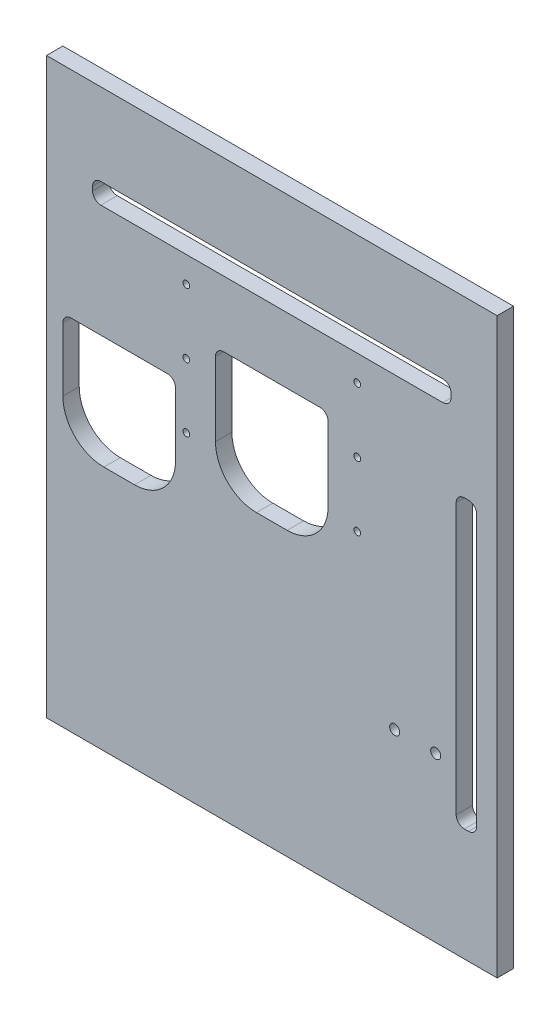
from build123d import *

# Parameters (mm, degrees)
ESQUISSE1_W                  = 220
ESQUISSE1_H                  = 280
BOSS_EXTRU_1_DEPTH           = 8
ESQUISSE2_R                  = 2
ENL_V_MAT_EXTRU_1_DEPTH      = 10
ENL_V_MAT_EXTRU_2_DEPTH      = 357.179729912
ENL_V_MAT_EXTRU_2_DEPTH_BACK = 357.179729912
ESQUISSE3_W                  = 55
ESQUISSE3_H                  = 60
ESQUISSE3_H_2                = 55
ESQUISSE3_W_2                = 10
ESQUISSE3_H_3                = 140
ENL_V_MAT_EXTRU_3_DEPTH      = 357.179729912
ENL_V_MAT_EXTRU_3_DEPTH_BACK = 357.179729912
ESQUISSE5_W                  = 175
ESQUISSE5_H                  = 10
ENL_V_MAT_EXTRU_4_DEPTH      = 357.179729912
ENL_V_MAT_EXTRU_4_DEPTH_BACK = 357.179729912
ESQUISSE6_R                  = 2.45
ENL_V_MAT_EXTRU_5_DEPTH      = 357.179729912
ENL_V_MAT_EXTRU_5_DEPTH_BACK = 357.179729912
ESQUISSE7_R                  = 1.65
CONG_1_R                     = 20
CONG_2_R                     = 4


with BuildPart() as part:
    # Esquisse1 → Boss.-Extru.1 (new body)
    with BuildSketch(Plane.XY):
        with Locations((110, 140)):
            Rectangle(ESQUISSE1_W, ESQUISSE1_H)
    extrude(amount=BOSS_EXTRU_1_DEPTH)

    # Esquisse2 → Enlèv. mat.-Extru.1 (cut)
    with BuildSketch(Plane.XZ):
        with Locations((110, 4)):
            Circle(ESQUISSE2_R)
        with Locations((210, 4)):
            Circle(ESQUISSE2_R)
        with Locations((10, 4)):
            Circle(ESQUISSE2_R)
    extrude(amount=-ENL_V_MAT_EXTRU_1_DEPTH, mode=Mode.SUBTRACT)

    # Esquisse3 → Enlèv. mat.-Extru.2 (cut, two sides: drawn at the far end of the back side and taken through both)
    with BuildSketch(Plane.XY.offset(8).offset(-ENL_V_MAT_EXTRU_2_DEPTH_BACK)):
        with Locations((110, 168)):
            Rectangle(ESQUISSE3_W, ESQUISSE3_H)
        with Locations((35.5, 147.5)):
            Rectangle(ESQUISSE3_W, ESQUISSE3_H_2)
        with Locations((205, 125)):
            Rectangle(ESQUISSE3_W_2, ESQUISSE3_H_3)
    extrude(amount=ENL_V_MAT_EXTRU_2_DEPTH + ENL_V_MAT_EXTRU_2_DEPTH_BACK, mode=Mode.SUBTRACT)

    # Esquisse5 → Enlèv. mat.-Extru.3 (cut, two sides: drawn at the far end of the back side and taken through both)
    with BuildSketch(Plane.XY.offset(8).offset(-ENL_V_MAT_EXTRU_3_DEPTH_BACK)):
        with Locations((110, 235)):
            Rectangle(ESQUISSE5_W, ESQUISSE5_H)
    extrude(amount=ENL_V_MAT_EXTRU_3_DEPTH + ENL_V_MAT_EXTRU_3_DEPTH_BACK, mode=Mode.SUBTRACT)

    # Esquisse6 → Enlèv. mat.-Extru.4 (cut, two sides: drawn at the far end of the back side and taken through both)
    with BuildSketch(Plane.XY.offset(8).offset(-ENL_V_MAT_EXTRU_4_DEPTH_BACK)):
        with Locations((190, 80)):
            Circle(ESQUISSE6_R)
        with Locations((170, 80)):
            Circle(ESQUISSE6_R)
    extrude(amount=ENL_V_MAT_EXTRU_4_DEPTH + ENL_V_MAT_EXTRU_4_DEPTH_BACK, mode=Mode.SUBTRACT)

    # Esquisse7 → Enlèv. mat.-Extru.5 (cut, two sides: drawn at the far end of the back side and taken through both)
    with BuildSketch(Plane.XY.offset(8).offset(-ENL_V_MAT_EXTRU_5_DEPTH_BACK)):
        with Locations((68.285, 217.4)):
            Circle(ESQUISSE7_R)
        with Locations((68.285, 186)):
            Circle(ESQUISSE7_R)
        with Locations((68.285, 154.6)):
            Circle(ESQUISSE7_R)
        with Locations((151.715, 154.6)):
            Circle(ESQUISSE7_R)
        with Locations((151.715, 186)):
            Circle(ESQUISSE7_R)
        with Locations((151.715, 217.4)):
            Circle(ESQUISSE7_R)
    extrude(amount=ENL_V_MAT_EXTRU_5_DEPTH + ENL_V_MAT_EXTRU_5_DEPTH_BACK, mode=Mode.SUBTRACT)

    # Congé1
    cong_1_edges = [part.edges().sort_by_distance(p)[0] for p in [
        (137.5, 138, 4),
        (82.5, 138, 4),
        (63, 120, 4),
        (8, 120, 4),
    ]]
    fillet(cong_1_edges, radius=CONG_1_R)

    # Congé2
    cong_2_edges = [part.edges().sort_by_distance(p)[0] for p in [
        (137.5, 198, 4),
        (82.5, 198, 4),
        (197.5, 230, 4),
        (197.5, 240, 4),
        (22.5, 240, 4),
        (22.5, 230, 4),
        (63, 175, 4),
        (8, 175, 4),
        (200, 195, 4),
        (210, 195, 4),
        (210, 55, 4),
        (200, 55, 4),
    ]]
    fillet(cong_2_edges, radius=CONG_2_R)


solid = part.part
